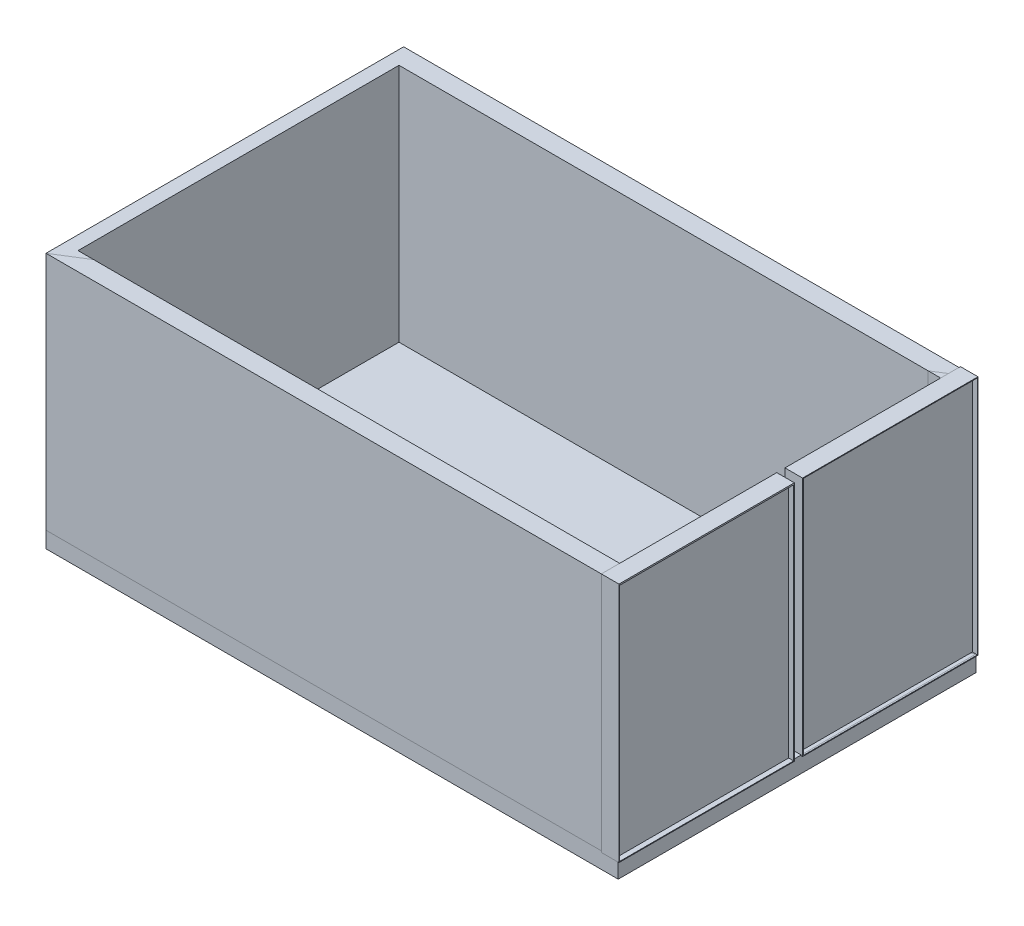
from build123d import *

# Parameters (mm, degrees)
SKETCH1_W                 = 8000
SKETCH1_H                 = 5000
SKETCH1_W_2               = 7616.83718919
SKETCH1_H_2               = 4487.2704
BOSS_EXTRUDE1_DEPTH       = 3352.8
SPLIT1_SURFACE_1_BACK     = 10013.056
SPLIT1_SURFACE_1_DEPTH    = 20026.112
SPLIT1_SURFACE_2_BACK     = 10013.056
SPLIT1_SURFACE_2_DEPTH    = 20026.112
SKETCH3_W                 = 8000
SKETCH3_H                 = 5000
BOSS_EXTRUDE2_DEPTH       = 225.8
SKETCH4_W                 = 5000
SKETCH4_H                 = 3352.8
CUT_EXTRUDE1_DEPTH        = 225.8
EXTRUDE_THIN4_OUTLINE_W   = 2432.713905463
EXTRUDE_THIN4_OUTLINE_H   = 3342.8
EXTRUDE_THIN4_OUTLINE_H_2 = 3352.8
EXTRUDE_THIN4_DEPTH       = 245.8
SKETCH6_W                 = 2432.713905463
SKETCH6_H                 = 3342.8
SKETCH6_H_2               = 3352.8
BOSS_EXTRUDE3_DEPTH       = 52.9


# Read off the part's stored shape, not the designer's step: Extrude-Thin4
with BuildPart() as part:
    # Sketch1 → Boss-Extrude1 (new body)
    with BuildSketch(Plane(origin=(0, 0, 0), x_dir=(1, 0, 0), z_dir=(0, 1, 0))):
        Rectangle(SKETCH1_W, SKETCH1_H)
        Rectangle(SKETCH1_W_2, SKETCH1_H_2, mode=Mode.SUBTRACT)
    extrude(amount=BOSS_EXTRUDE1_DEPTH)


with BuildPart() as body_2:
    # Split1: the piece behind the surface
    add(part.part)
    # Split1 surface: a surface, the sketch's curves swept straight by 20026.112 mm
    with BuildLine(Plane(origin=(0, 3352.8, 0), x_dir=(1, 0, 0), z_dir=(0, 1, 0)).offset(-SPLIT1_SURFACE_1_BACK), mode=Mode.PRIVATE) as split1_surface_1_path:
        Line((-4000, -2500), (4000, 2500))
    split1_surface_1 = Shell.extrude(split1_surface_1_path.wire(), (0 * SPLIT1_SURFACE_1_DEPTH, 1 * SPLIT1_SURFACE_1_DEPTH, 0 * SPLIT1_SURFACE_1_DEPTH))
    split(bisect_by=split1_surface_1, keep=Keep.BOTTOM)


with BuildPart() as part_1:
    add(part.part)

    # Split1: split by a surface, the side it looks to stays
    # Split1 surface: a surface, the sketch's curves swept straight by 20026.112 mm
    with BuildLine(Plane(origin=(0, 3352.8, 0), x_dir=(1, 0, 0), z_dir=(0, 1, 0)).offset(-SPLIT1_SURFACE_2_BACK), mode=Mode.PRIVATE) as split1_surface_2_path:
        Line((-4000, -2500), (4000, 2500))
    split1_surface_2 = Shell.extrude(split1_surface_2_path.wire(), (0 * SPLIT1_SURFACE_2_DEPTH, 1 * SPLIT1_SURFACE_2_DEPTH, 0 * SPLIT1_SURFACE_2_DEPTH))
    split(bisect_by=split1_surface_2, keep=Keep.TOP)


with BuildPart() as body_3:
    # Sketch3 → Boss-Extrude2 (new body)
    with BuildSketch(Plane.XZ):
        Rectangle(SKETCH3_W, SKETCH3_H)
    extrude(amount=BOSS_EXTRUDE2_DEPTH)


with BuildPart() as cut_extrude1_tool:
    # Sketch4 → Cut-Extrude1 (new body)
    with BuildSketch(Plane(origin=(4000, 0, 0), x_dir=(0, 0, -1), z_dir=(1, 0, 0))):
        with Locations((0, 1676.4)):
            Rectangle(SKETCH4_W, SKETCH4_H)
    extrude(amount=-CUT_EXTRUDE1_DEPTH)


with BuildPart() as part_2:
    add(part_1.part)

    # Cut-Extrude1: cut by cut_extrude1_tool
    add(cut_extrude1_tool.part, mode=Mode.SUBTRACT)


with BuildPart() as body_2_1:
    add(body_2.part)

    # Cut-Extrude1: cut by cut_extrude1_tool
    add(cut_extrude1_tool.part, mode=Mode.SUBTRACT)


with BuildPart() as body_4:
    # Extrude-Thin4 outline → Extrude-Thin4 (new body)
    # profile 1 of 2: a face of its own
    with BuildSketch(Plane(origin=(3774.2, 0, 0), x_dir=(0, 0, -1), z_dir=(1, 0, 0))):
        Polygon((-57.286094537, -10), (-57.286094537, 0), (-57.286094537, 3362.8), (-2510, 3362.8), (-2510, -10), align=None)
        with Locations((-1283.643047268, 1671.4)):
            Rectangle(EXTRUDE_THIN4_OUTLINE_W, EXTRUDE_THIN4_OUTLINE_H, mode=Mode.SUBTRACT)
    # profile 2 of 2: a face of its own
    with BuildSketch(Plane(origin=(3774.2, 0, 0), x_dir=(0, 0, -1), z_dir=(1, 0, 0))):
        Polygon((57.286094537, 3362.8), (57.286094537, 0), (57.286094537, -10), (2510, -10), (2510, 3362.8), align=None)
        with Locations((1283.643047268, 1676.4)):
            Rectangle(EXTRUDE_THIN4_OUTLINE_W, EXTRUDE_THIN4_OUTLINE_H_2, mode=Mode.SUBTRACT)
    extrude(amount=EXTRUDE_THIN4_DEPTH)

    # Sketch6 → Boss-Extrude3 (add, symmetric)
    with BuildSketch(Plane(origin=(3897.1, 0, 0), x_dir=(0, 0, -1), z_dir=(1, 0, 0))):
        with Locations((-1283.643047268, 1671.4)):
            Rectangle(SKETCH6_W, SKETCH6_H)
        with Locations((1283.643047268, 1676.4)):
            Rectangle(SKETCH6_W, SKETCH6_H_2)
    extrude(amount=BOSS_EXTRUDE3_DEPTH, both=True)


solid = Compound([body_3.part, part_2.part, body_2_1.part, body_4.part])
